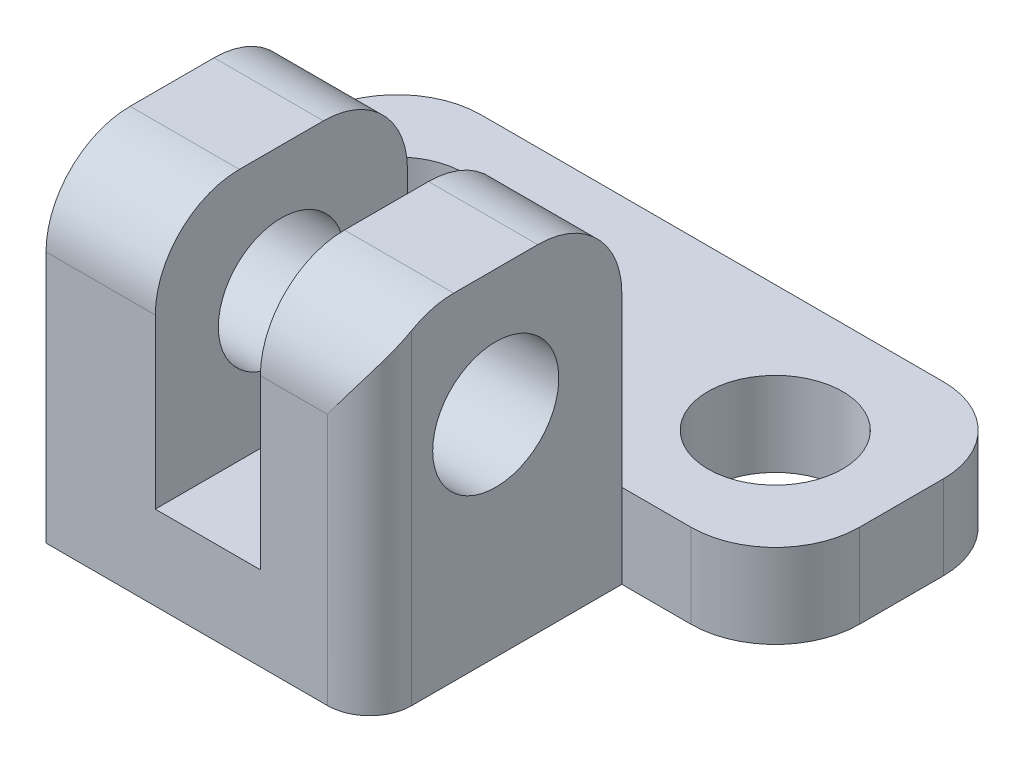
from build123d import *

# Parameters (mm, degrees)
SKETCH1_W             = 7.7
SKETCH1_H             = 6
BOSS_EXTRUDE1_DEPTH   = 8
SKETCH2_W             = 2.5
SKETCH2_H             = 6
CUT_EXTRUDE1_DEPTH    = 6
F_3_0MM_DOWEL_HOLE1_D = 3
SKETCH7_W             = 15
SKETCH7_H             = 6
BOSS_EXTRUDE2_DEPTH   = 2
M3_CLEARANCE_HOLE1_D  = 3.2
FILLET1_R             = 2
FILLET2_R             = 1


with BuildPart() as part:
    # Sketch1 → Boss-Extrude1 (new body)
    with BuildSketch(Plane(origin=(0, 0, 0), x_dir=(1, 0, 0), z_dir=(0, 1, 0))):
        with Locations((3.85, 3)):
            Rectangle(SKETCH1_W, SKETCH1_H)
    extrude(amount=BOSS_EXTRUDE1_DEPTH)

    # Sketch2 → Cut-Extrude1 (cut)
    with BuildSketch(Plane(origin=(0, 8, 0), x_dir=(1, 0, 0), z_dir=(0, 1, 0))):
        with Locations((3.85, 3)):
            Rectangle(SKETCH2_W, SKETCH2_H)
    extrude(amount=-CUT_EXTRUDE1_DEPTH, mode=Mode.SUBTRACT)

    # Ø3.0mm Dowel Hole1 (through all)
    with Locations(Plane.ZY):
        with Locations((-3, 5)):
            Hole(F_3_0MM_DOWEL_HOLE1_D / 2)

    # Sketch7 → Boss-Extrude2 (add)
    with BuildSketch(Plane.XZ):
        with Locations((3.85, -9)):
            Rectangle(SKETCH7_W, SKETCH7_H)
    extrude(amount=-BOSS_EXTRUDE2_DEPTH)

    # M3 Clearance Hole1 (through all)
    with Locations(Plane(origin=(0, 2, 0), x_dir=(1, 0, 0), z_dir=(0, 1, 0))):
        with Locations((-0.65, 9), (8.35, 9)):
            Hole(M3_CLEARANCE_HOLE1_D / 2)

    # Fillet1
    fillet1_edges = [part.edges().sort_by_distance(p)[0] for p in [
        (6.4, 8, 0),
        (1.3, 8, -6),
        (6.4, 8, -6),
        (-3.65, 1, -6),
        (-3.65, 1, -12),
        (11.35, 1, -6),
        (11.35, 1, -12),
        (1.3, 8, 0),
    ]]
    fillet(fillet1_edges, radius=FILLET1_R)

    # Fillet2
    # the kernel refuses this fillet: 1 mm, written as the material it takes off along each edge
    with BuildSketch(Plane(origin=(7.7, -2.5, 0), x_dir=(-1, 0, 0), z_dir=(0, 1, 0))) as fillet2_piece_1:
        with BuildLine():
            CenterArc((FILLET2_R, -FILLET2_R), FILLET2_R, 90, 90)
            Line((0, -FILLET2_R), (0, 0))
            Line((0, 0), (FILLET2_R, 0))
        make_face()
    extrude(amount=11, mode=Mode.SUBTRACT)


solid = part.part
